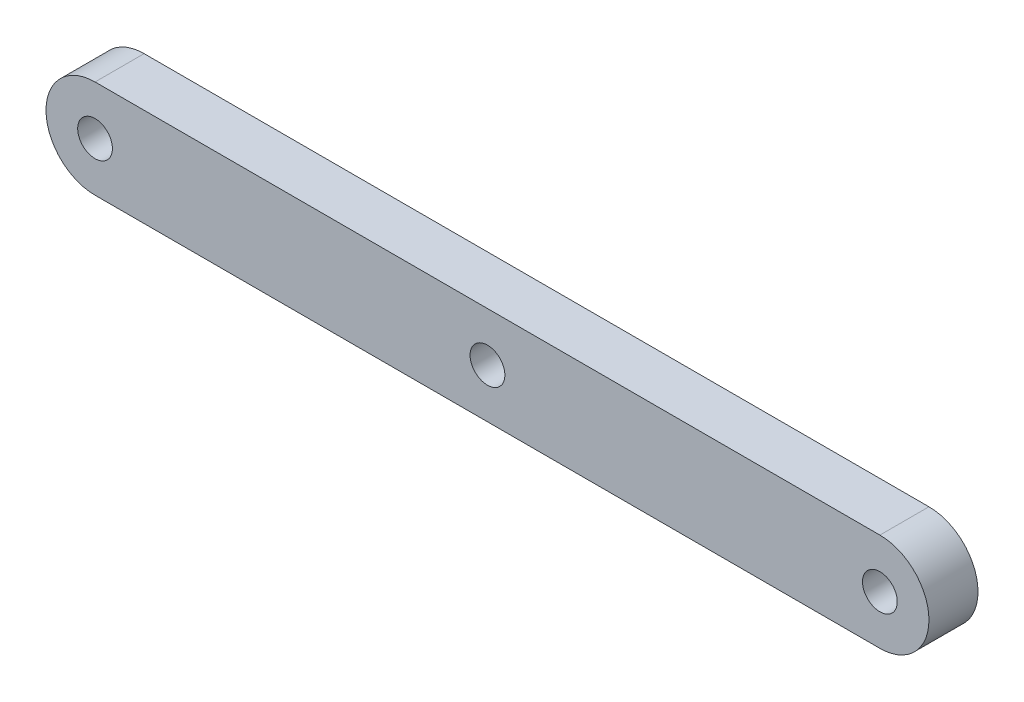
from build123d import *

# Parameters (mm, degrees)
BOSS_EXTRUDE1_DEPTH  = 6.35
M4_CLEARANCE_HOLE2_D = 4.5
M4_CLEARANCE_HOLE1_D = 4.5


with BuildPart() as part:
    # Sketch1 → Boss-Extrude1 (new body)
    with BuildSketch(Plane.XY):
        with BuildLine():
            Line((0, 6.35), (101.6, 6.35))
            ThreePointArc((101.6, 6.35), (107.95, 0), (101.6, -6.35))
            Line((101.6, -6.35), (0, -6.35))
            ThreePointArc((0, -6.35), (-6.35, 0), (0, 6.35))
        make_face()
    extrude(amount=BOSS_EXTRUDE1_DEPTH)

    # M4 Clearance Hole2 (through all)
    with Locations(Plane(origin=(0, 0, 0), x_dir=(-1, 0, 0), z_dir=(0, 0, -1))):
        with Locations((-101.6, 0)):
            m4_clearance_hole2 = Hole(M4_CLEARANCE_HOLE2_D / 2)

    # M4 Clearance Hole1 (through all)
    with Locations(Plane(origin=(0, 0, 0), x_dir=(-1, 0, 0), z_dir=(0, 0, -1))):
        with Locations((-50.8, 0)):
            Hole(M4_CLEARANCE_HOLE1_D / 2)

    # Mirror1: M4 Clearance Hole2 across plane
    add(m4_clearance_hole2.mirror(Plane(origin=(50.8, 0, 0), x_dir=(0, 0, 1), z_dir=(1, 0, 0))), mode=Mode.SUBTRACT)


solid = part.part
